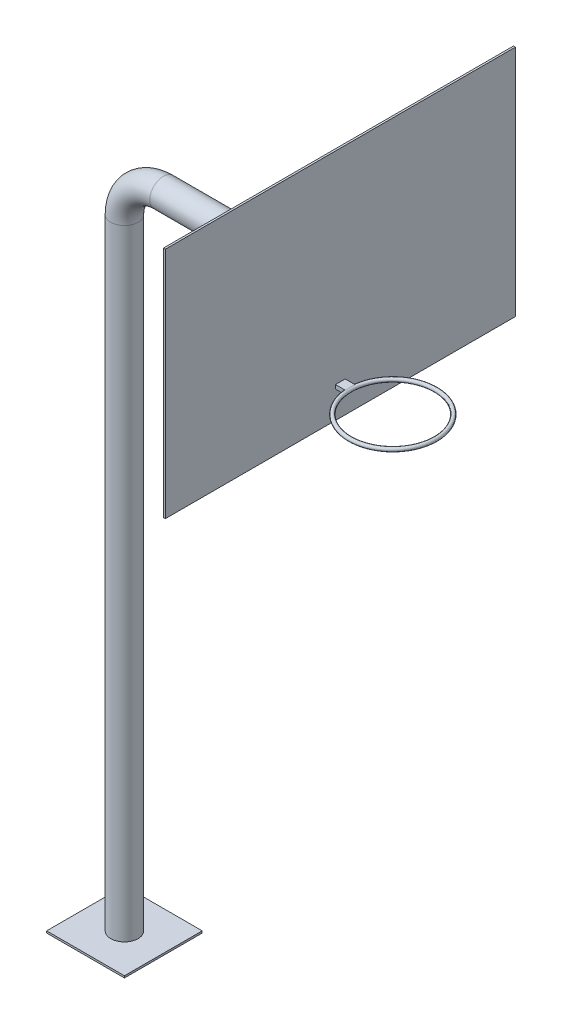
from build123d import *

# Parameters (mm, degrees)
IZIM1_W                     = 400
IZIM1_H                     = 400
Y_KSEKLIK_EKSTR_ZYON1_DEPTH = 10
IZIM2_R                     = 70
IZIM2_R_2                   = 60
IZIM5_W                     = 1800
IZIM5_H                     = 1200
Y_KSEKLIK_EKSTR_ZYON2_DEPTH = 10
IZIM11_R                    = 10
Y_KSEKLIK_EKSTR_ZYON6_START = 2990
Y_KSEKLIK_EKSTR_ZYON6_DEPTH = 20


with BuildPart() as part:
    # Çizim1 → Yükseklik-Ekstrüzyon1 (new body)
    with BuildSketch(Plane(origin=(0, 0, 0), x_dir=(1, 0, 0), z_dir=(0, 1, 0))):
        Rectangle(IZIM1_W, IZIM1_H)
    extrude(amount=Y_KSEKLIK_EKSTR_ZYON1_DEPTH)

    # Süpür1: sweep along a path in Çizim3
    with BuildLine(Plane.XY) as s_p_r1_path:
        Line((0, 0), (0, 3200))
        ThreePointArc((0, 3200), (58.578643763, 3341.421356237), (200, 3400))
        Line((200, 3400), (1100, 3400))
    # Çizim2 → Süpür1 (sweep)
    with BuildSketch(Plane(origin=(0, 0, 0), x_dir=(1, 0, 0), z_dir=(0, 1, 0))):
        Circle(IZIM2_R)
        Circle(IZIM2_R_2, mode=Mode.SUBTRACT)
    sweep(path=s_p_r1_path.line)

    # Çizim5 → Yükseklik-Ekstrüzyon2 (add)
    with BuildSketch(Plane(origin=(1100, 0, 0), x_dir=(0, 0, -1), z_dir=(1, 0, 0))):
        with Locations((0, 3450)):
            Rectangle(IZIM5_W, IZIM5_H)
    extrude(amount=Y_KSEKLIK_EKSTR_ZYON2_DEPTH)



with BuildPart() as body_2:
    # Çizim11 → Döndür1 (revolve)
    with BuildSketch(Plane.XY):
        with Locations((1160, 3000)):
            Circle(IZIM11_R)
    revolve(axis=Axis((1380, 3213.20754823, 0), (0, -1, 0)))


with BuildPart() as part_1:
    add(part.part)

    add(body_2.part)  # Yükseklik-Ekstrüzyon6 merges body 2
    # Yükseklik-Ekstrüzyon6: read off the stored shape, not the designer's step
    # Yükseklik-Ekstrüzyon6 outline → Yükseklik-Ekstrüzyon6 (add)
    with BuildSketch(Plane(origin=(0, 0, 0), x_dir=(1, 0, 0), z_dir=(0, 1, 0)).offset(Y_KSEKLIK_EKSTR_ZYON6_START)):
        with BuildLine():
            Line((1110, -25), (1161.425070056, -25))
            ThreePointArc((1161.425070056, -25), (1160, 0), (1161.425070056, 25))
            Line((1161.425070056, 25), (1110, 25))
            Line((1110, 25), (1110, -25))
        make_face()
    extrude(amount=Y_KSEKLIK_EKSTR_ZYON6_DEPTH)


solid = part_1.part
